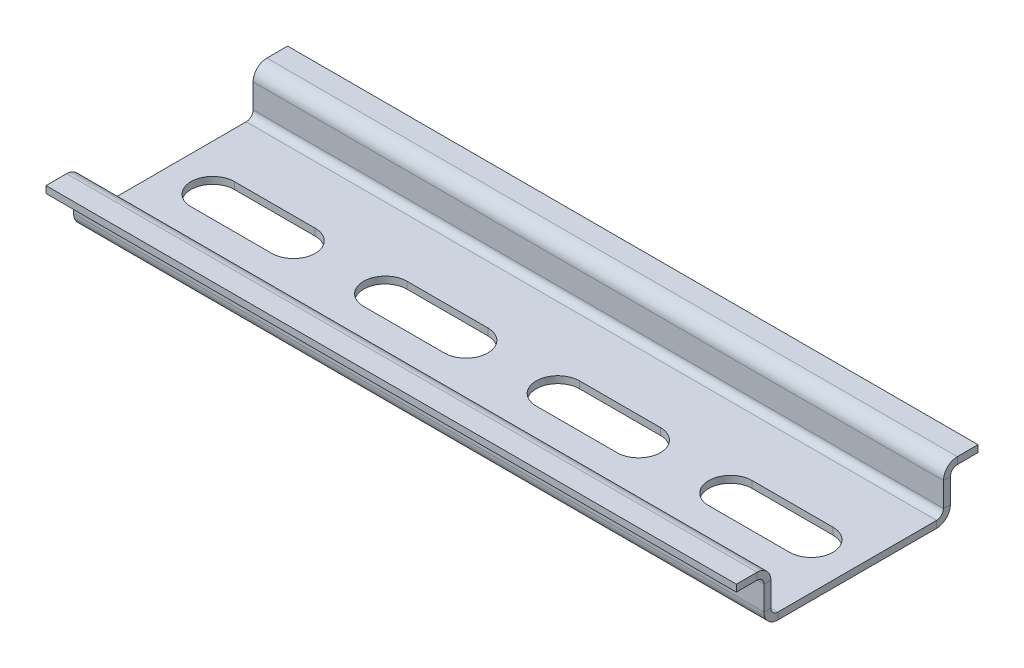
from build123d import *

# Parameters (mm, degrees)
SM_BASE_FLANGE_1_DEPTH = 100
CUT_EXTRUDE_1_DEPTH    = 102.727577382
PATTERN_LINEAR_6_COUNT = 4
PATTERN_LINEAR_6_PITCH = 25


# Sheet-metal steps are written as plain solids
with BuildPart() as part:
    # Sketch 1 → Базовая кромка1 (new body)
    with BuildSketch(Plane(origin=(0, 0, 0), x_dir=(0, 0, -1), z_dir=(1, 0, 0))):
        with BuildLine():
            Line((-17.5, 6.5), (-14.5, 6.5))
            ThreePointArc((-14.5, 6.5), (-13.792893219, 6.207106781), (-13.5, 5.5))
            Line((-13.5, 5.5), (-13.5, 2))
            ThreePointArc((-13.5, 2), (-12.914213562, 0.585786438), (-11.5, 0))
            Line((-11.5, 0), (11.5, 0))
            ThreePointArc((11.5, 0), (12.914213562, 0.585786438), (13.5, 2))
            Line((13.5, 2), (13.5, 5.5))
            ThreePointArc((13.5, 5.5), (13.792893219, 6.207106781), (14.5, 6.5))
            Line((14.5, 6.5), (17.5, 6.5))
            Line((17.5, 6.5), (17.5, 7.5))
            Line((17.5, 7.5), (14.5, 7.5))
            ThreePointArc((14.5, 7.5), (13.085786438, 6.914213562), (12.5, 5.5))
            Line((12.5, 5.5), (12.5, 2))
            ThreePointArc((12.5, 2), (12.207106781, 1.292893219), (11.5, 1))
            Line((11.5, 1), (-11.5, 1))
            ThreePointArc((-11.5, 1), (-12.207106781, 1.292893219), (-12.5, 2))
            Line((-12.5, 2), (-12.5, 5.5))
            ThreePointArc((-12.5, 5.5), (-13.085786438, 6.914213562), (-14.5, 7.5))
            Line((-14.5, 7.5), (-17.5, 7.5))
            Line((-17.5, 7.5), (-17.5, 6.5))
        make_face()
    extrude(amount=SM_BASE_FLANGE_1_DEPTH)

    # Эскиз6 → Вырез-Вытянуть1 (cut, through all)
    with BuildSketch(Plane(origin=(0, 1, 0), x_dir=(1, 0, 0), z_dir=(0, 1, 0))):
        with BuildLine():
            Line((6.65, 3.15), (18.35, 3.15))
            ThreePointArc((18.35, 3.15), (21.5, 0), (18.35, -3.15))
            Line((18.35, -3.15), (6.65, -3.15))
            ThreePointArc((6.65, -3.15), (3.5, 0), (6.65, 3.15))
        make_face()
    cut_extrude_1 = extrude(amount=-CUT_EXTRUDE_1_DEPTH, mode=Mode.SUBTRACT)

    # Линейный массив6: Вырез-Вытянуть1 ×4
    with Locations(*[(i * PATTERN_LINEAR_6_PITCH, 0, 0) for i in range(1, PATTERN_LINEAR_6_COUNT)]):
        add(cut_extrude_1, mode=Mode.SUBTRACT)


solid = part.part
